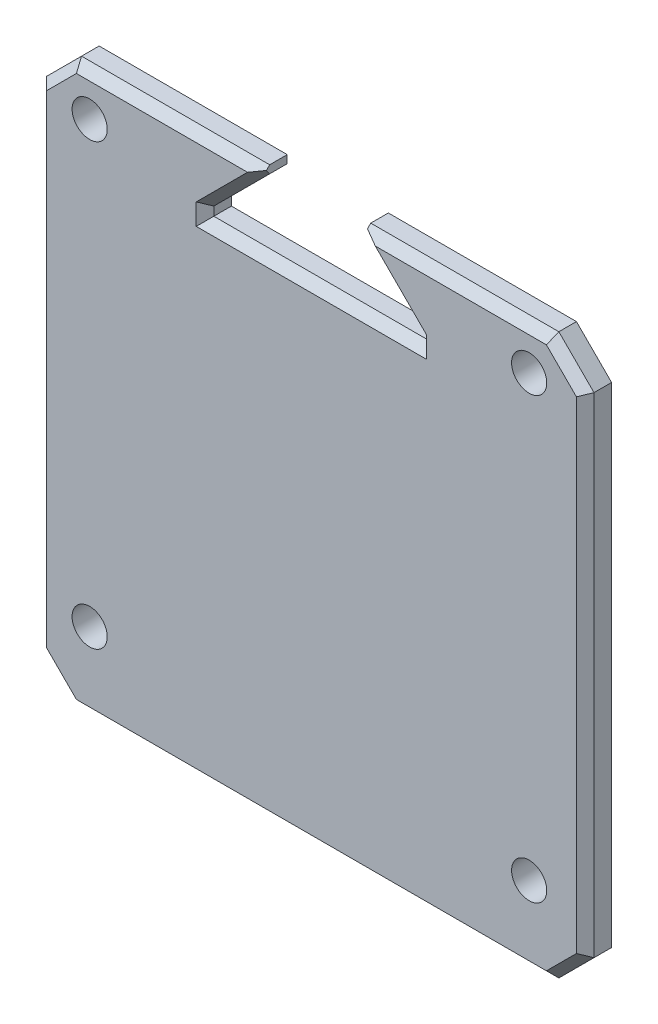
from build123d import *

# Parameters (mm, degrees)
BOSS_EXTRUDE1_DEPTH = 3
CUT_EXTRUDE4_DEPTH  = 10
CHAMFER1_SIZE       = 1
SKETCH4_R           = 2
CUT_EXTRUDE5_DEPTH  = 10


with BuildPart() as part:
    # Sketch3 → Boss-Extrude1 (new body)
    with BuildSketch(Plane.XY):
        Polygon((-26.921356186, 32.06604295), (27.378643814, 32.06604295), (31.378643814, 28.06604295), (31.378643814, -27.608755321), (27.378643814, -31.608755321), (-26.921356186, -31.608755321), (-30.921356186, -27.608755321), (-30.921356186, 28.06604295), align=None)
    extrude(amount=BOSS_EXTRUDE1_DEPTH)

    # Sketch2 → Cut-Extrude4 (cut)
    with BuildSketch(Plane.XY):
        Polygon((-11.874909576, 24.81604295), (-11.874909576, 23.81604295), (12.332197205, 23.81604295), (12.332197205, 24.81604295), (5.978643814, 31.16959634), (5.978643814, 32.31604295), (-5.521356186, 32.31604295), (-5.521356186, 31.16959634), align=None)
    extrude(amount=CUT_EXTRUDE4_DEPTH, mode=Mode.SUBTRACT)

    # Chamfer1
    chamfer1_edges = [part.edges().sort_by_distance(p)[0] for p in [
        (-16.221356186, 32.06604295, 3),
    ]]
    chamfer(chamfer1_edges, length=CHAMFER1_SIZE)
    chamfer1_2_edges = [part.edges().sort_by_distance(p)[0] for p in [
        (-29.421356186, 29.56604295, 3),
    ]]
    chamfer(chamfer1_2_edges, length=CHAMFER1_SIZE)
    chamfer1_3_edges = [part.edges().sort_by_distance(p)[0] for p in [
        (-30.921356186, -0.478462967, 3),
    ]]
    chamfer(chamfer1_3_edges, length=CHAMFER1_SIZE)
    chamfer1_4_edges = [part.edges().sort_by_distance(p)[0] for p in [
        (-28.421356186, -30.108755321, 3),
    ]]
    chamfer(chamfer1_4_edges, length=CHAMFER1_SIZE)
    chamfer1_5_edges = [part.edges().sort_by_distance(p)[0] for p in [
        (0.935750595, -31.608755321, 3),
    ]]
    chamfer(chamfer1_5_edges, length=CHAMFER1_SIZE)
    chamfer1_6_edges = [part.edges().sort_by_distance(p)[0] for p in [
        (29.878643814, -29.108755321, 3),
    ]]
    chamfer(chamfer1_6_edges, length=CHAMFER1_SIZE)
    chamfer1_7_edges = [part.edges().sort_by_distance(p)[0] for p in [
        (31.378643814, 0.935750595, 3),
    ]]
    chamfer(chamfer1_7_edges, length=CHAMFER1_SIZE)
    chamfer1_8_edges = [part.edges().sort_by_distance(p)[0] for p in [
        (28.878643814, 30.56604295, 3),
    ]]
    chamfer(chamfer1_8_edges, length=CHAMFER1_SIZE)
    chamfer1_9_edges = [part.edges().sort_by_distance(p)[0] for p in [
        (15.971537033, 32.06604295, 3),
    ]]
    chamfer(chamfer1_9_edges, length=CHAMFER1_SIZE)
    chamfer1_10_edges = [part.edges().sort_by_distance(p)[0] for p in [
        (9.207197205, 27.94104295, 3),
    ]]
    chamfer(chamfer1_10_edges, length=CHAMFER1_SIZE)
    chamfer1_11_edges = [part.edges().sort_by_distance(p)[0] for p in [
        (12.332197205, 24.31604295, 3),
    ]]
    chamfer(chamfer1_11_edges, length=CHAMFER1_SIZE)
    chamfer1_12_edges = [part.edges().sort_by_distance(p)[0] for p in [
        (0.228643814, 23.81604295, 3),
    ]]
    chamfer(chamfer1_12_edges, length=CHAMFER1_SIZE)
    chamfer1_13_edges = [part.edges().sort_by_distance(p)[0] for p in [
        (-11.874909576, 24.31604295, 3),
    ]]
    chamfer(chamfer1_13_edges, length=CHAMFER1_SIZE)
    chamfer1_14_edges = [part.edges().sort_by_distance(p)[0] for p in [
        (-8.749909576, 27.94104295, 3),
    ]]
    chamfer(chamfer1_14_edges, length=CHAMFER1_SIZE)

    # Sketch4 → Cut-Extrude5 (cut)
    with BuildSketch(Plane.XY.offset(3)):
        with Locations((-25, 27.31604295)):
            Circle(SKETCH4_R)
        with Locations(Location((25, 27.31604295, 0), (0, 0, 180))):
            Circle(SKETCH4_R)
        with Locations((25, -22.68395705)):
            Circle(SKETCH4_R)
        with Locations(Location((-25, -22.68395705, 0), (0, 0, 180))):
            Circle(SKETCH4_R)
    extrude(amount=-CUT_EXTRUDE5_DEPTH, mode=Mode.SUBTRACT)


solid = part.part
